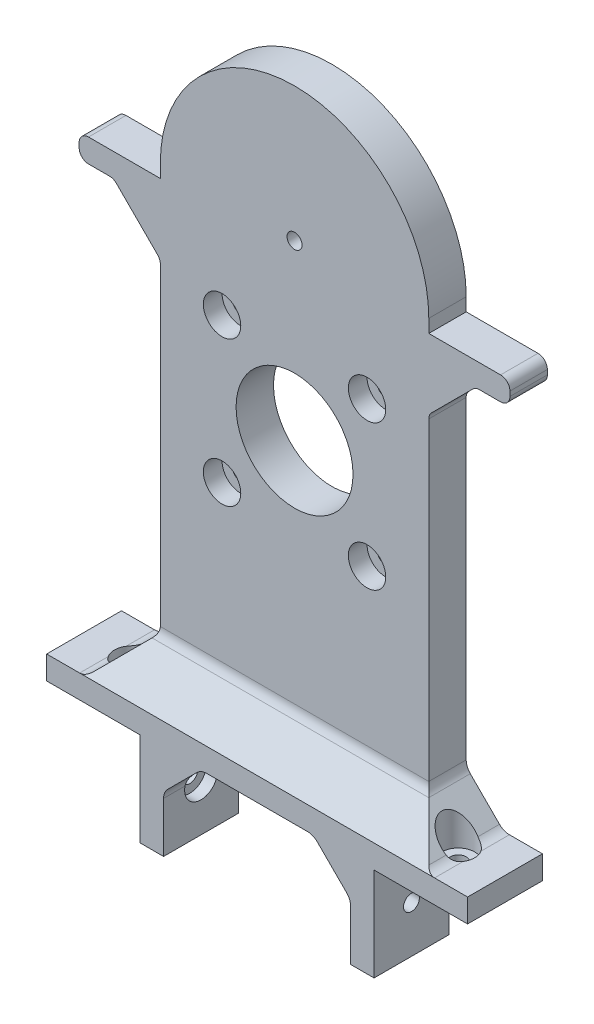
from build123d import *

# Parameters (mm, degrees)
RESSALTO_EXTRUS_O1_DEPTH                     = 8
RESSALTO_EXTRUS_O2_DEPTH                     = 8
CHANFRO1_SIZE                                = 8
ESBO_O3_R                                    = 1.6
ESBO_O3_R_2                                  = 12.5
CORTE_EXTRUS_O1_DEPTH                        = 138.275962936
FILETE1_R                                    = 3
REBAIXO_PARA_PARAFUSO_COM_CABE_A_PAN_2_COUNT = 2
REBAIXO_PARA_PARAFUSO_COM_CABE_A_PAN_2_PITCH = 70
CORTE_EXTRUS_O3_START                        = 10
ESBO_O13_R                                   = 3.5
CORTE_EXTRUS_O3_DEPTH                        = 10
ESBO_O18_R                                   = 3.5
CORTE_EXTRUS_O4_DEPTH                        = 2
ESBO_O19_R                                   = 1.8
CORTE_EXTRUS_O5_DEPTH                        = 137.574851278
ESBO_O20_R                                   = 4
CORTE_EXTRUS_O6_DEPTH                        = 4
ESBO_O21_W                                   = 17.35
ESBO_O21_H                                   = 5
RESSALTO_EXTRUS_O3_DEPTH                     = 8
FILETE2_R                                    = 2
CHANFRO2_SIZE                                = 10
FILETE3_R                                    = 2


with BuildPart() as part:
    # Esboço1 → Ressalto-extrusão1 (new body)
    with BuildSketch(Plane.XY):
        with BuildLine():
            Line((28.7, 5), (28.7, 100))
            ThreePointArc((28.7, 100), (0, 128.7), (-28.7, 100))
            Line((-28.7, 100), (-28.7, 5))
            Line((-28.7, 5), (-45, 5))
            Line((-45, 5), (-45, 0))
            Line((-45, 0), (-25, 0))
            Line((-25, 0), (-25, -20))
            Line((-25, -20), (-20, -20))
            Line((-20, -20), (-20, 0))
            Line((-20, 0), (20, 0))
            Line((20, 0), (20, -20))
            Line((20, -20), (25, -20))
            Line((25, -20), (25, 0))
            Line((25, 0), (45, 0))
            Line((45, 0), (45, 5))
            Line((45, 5), (28.7, 5))
        make_face()
    extrude(amount=RESSALTO_EXTRUS_O1_DEPTH)

    # Esboço2 → Ressalto-extrusão2 (add)
    with BuildSketch(Plane.XY.offset(8)):
        Polygon((-20, -20), (-25, -20), (-25, 0), (-45, 0), (-45, 5), (45, 5), (45, 0), (25, 0), (25, -20), (20, -20), (20, 0), (-20, 0), align=None)
    extrude(amount=RESSALTO_EXTRUS_O2_DEPTH)

    # Chanfro1
    chanfro1_edges = [part.edges().sort_by_distance(p)[0] for p in [
        (28.7, 5, 4),
        (20, 0, 8),
        (-20, 0, 8),
        (-28.7, 5, 4),
        (0, 5, 8),
    ]]
    chamfer(chanfro1_edges, length=CHANFRO1_SIZE - 0.0001)  # a hair under: the kernel refuses the full size

    # Esboço3 → Corte-extrusão1 (cut, through all)
    with BuildSketch(Plane(origin=(0, 0, 0), x_dir=(-1, 0, 0), z_dir=(0, 0, -1))):
        with Locations((0, 100)):
            Circle(ESBO_O3_R)
        with Locations((0, 63)):
            Circle(ESBO_O3_R_2)
    extrude(amount=-CORTE_EXTRUS_O1_DEPTH, mode=Mode.SUBTRACT)

    # Filete1
    filete1_edges = [part.edges().sort_by_distance(p)[0] for p in [
        (28.7, 12.9999, 4),
        (-36.6999, 5, 7.99995),
        (36.6999, 5, 7.99995),
        (-28.7, 12.9999, 4),
        (0, 12.9999, 8),
        (20, -7.9999, 8),
        (-12.0001, 0, 8),
        (12.0001, 0, 8),
        (-20, -7.9999, 8),
    ]]
    fillet(filete1_edges, radius=FILETE1_R)

    # Esboço12 → Rebaixo para parafuso com cabe_a panela (revolve, cut)
    with BuildSketch(Plane(origin=(35, 5, 8), x_dir=(0, 0, 1), z_dir=(1, 0, 0))):
        Polygon((0, 0), (0, 7.021463052), (1.7, 6), (1.7, 2.4), (3.5, 2.4), (3.5, 0), align=None)
    rebaixo_para_parafuso_com_cabe_a_panela = revolve(axis=Axis((35, 11.35, 8), (0, -1, 0)), mode=Mode.SUBTRACT)

    # Rebaixo para parafuso com cabe_a pan 2: Rebaixo para parafuso com cabe_a panela ×2
    with Locations(*[(-i * REBAIXO_PARA_PARAFUSO_COM_CABE_A_PAN_2_PITCH, 0, 0) for i in range(1, REBAIXO_PARA_PARAFUSO_COM_CABE_A_PAN_2_COUNT)]):
        add(rebaixo_para_parafuso_com_cabe_a_panela, mode=Mode.SUBTRACT)

    # Esboço13 → Corte-extrusão3 (cut)
    with BuildSketch(Plane(origin=(0, 5, 0), x_dir=(1, 0, 0), z_dir=(0, 1, 0)).offset(CORTE_EXTRUS_O3_START)):
        with Locations(Location((-35, -8, 0), (0, 0, 270))):
            Circle(ESBO_O13_R)
        with Locations(Location((35, -8, 0), (0, 0, 270))):
            Circle(ESBO_O13_R)
    extrude(amount=-CORTE_EXTRUS_O3_DEPTH, mode=Mode.SUBTRACT)

    # Esboço15 → Rebaixo para parafuso com cabe_a pan 3 (revolve, cut)
    with BuildSketch(Plane(origin=(20, -10, 8), x_dir=(0, 0, 1), z_dir=(0, 1, 0))):
        Polygon((0, 0), (0, 7.021463052), (1.7, 6), (1.7, 2.4), (3.5, 2.4), (3.5, 0), align=None)
    revolve(axis=Axis((13.65, -10, 8), (1, 0, 0)), mode=Mode.SUBTRACT)

    # Esboço17 → Rebaixo para parafuso com cabe_a pan 4 (revolve, cut)
    with BuildSketch(Plane(origin=(-20, -10, 8), x_dir=(0, 0, -1), z_dir=(0, 1, 0))):
        Polygon((0, 0), (0, 7.021463052), (1.7, 6), (1.7, 2.4), (3.5, 2.4), (3.5, 0), align=None)
    revolve(axis=Axis((-13.65, -10, 8), (-1, 0, 0)), mode=Mode.SUBTRACT)

    # Esboço18 → Corte-extrusão4 (cut)
    with BuildSketch(Plane.ZY.offset(-20)):
        with Locations((8, -10)):
            Circle(ESBO_O18_R)
    corte_extrus_o4 = extrude(amount=CORTE_EXTRUS_O4_DEPTH, mode=Mode.SUBTRACT)

    # Espelhar1: Corte-extrusão4 across plane
    add(corte_extrus_o4.mirror(Plane(origin=(0, 0, 0), x_dir=(0, 0, 1), z_dir=(1, 0, 0))), mode=Mode.SUBTRACT)

    # Esboço19 → Corte-extrusão5 (cut, through all)
    with BuildSketch(Plane.XY.offset(8)):
        with Locations((15.5, 78.5)):
            Circle(ESBO_O19_R)
        with Locations((15.5, 47.5)):
            Circle(ESBO_O19_R)
        with Locations((-15.5, 47.5)):
            Circle(ESBO_O19_R)
        with Locations((-15.5, 78.5)):
            Circle(ESBO_O19_R)
    extrude(amount=-CORTE_EXTRUS_O5_DEPTH, mode=Mode.SUBTRACT)

    # Esboço20 → Corte-extrusão6 (cut)
    with BuildSketch(Plane.XY.offset(8)):
        with Locations((15.5, 78.5)):
            Circle(ESBO_O20_R)
        with Locations((15.5, 47.5)):
            Circle(ESBO_O20_R)
        with Locations((-15.5, 47.5)):
            Circle(ESBO_O20_R)
        with Locations((-15.5, 78.5)):
            Circle(ESBO_O20_R)
    extrude(amount=-CORTE_EXTRUS_O6_DEPTH, mode=Mode.SUBTRACT)

    # Esboço21 → Ressalto-extrusão3 (add)
    with BuildSketch(Plane(origin=(0, 0, 0), x_dir=(-1, 0, 0), z_dir=(0, 0, -1))):
        with Locations((-37.375, 94.7)):
            Rectangle(ESBO_O21_W, ESBO_O21_H)
        with Locations((37.375, 94.7)):
            Rectangle(ESBO_O21_W, ESBO_O21_H)
    extrude(amount=-RESSALTO_EXTRUS_O3_DEPTH)

    # Filete2
    filete2_edges = [part.edges().sort_by_distance(p)[0] for p in [
        (46.05, 97.2, 4),
        (46.05, 92.2, 4),
        (-46.05, 92.2, 4),
        (-46.05, 97.2, 4),
    ]]
    fillet(filete2_edges, radius=FILETE2_R)

    # Chanfro2
    chanfro2_edges = [part.edges().sort_by_distance(p)[0] for p in [
        (28.7, 92.2, 4),
        (-28.7, 92.2, 4),
    ]]
    chamfer(chanfro2_edges, length=CHANFRO2_SIZE)

    # Filete3
    filete3_edges = [part.edges().sort_by_distance(p)[0] for p in [
        (38.7, 92.2, 4),
        (28.7, 82.2, 4),
        (-28.7, 82.2, 4),
        (-38.7, 92.2, 4),
    ]]
    fillet(filete3_edges, radius=FILETE3_R)


solid = part.part
